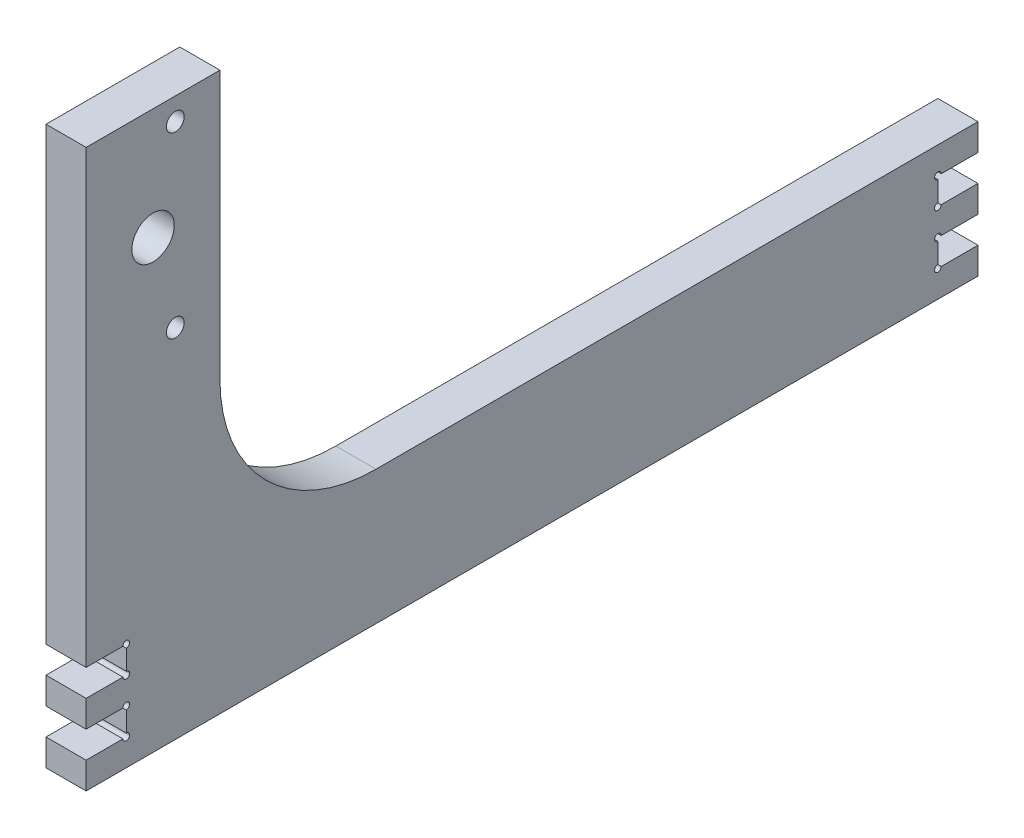
from build123d import *

# Parameters (mm, degrees)
SKETCH1_R           = 4
BOSS_EXTRUDE1_DEPTH = 18
CUT_EXTRUDE1_REACH  = 448.905
SKETCH3_R           = 9.5


with BuildPart() as part:
    # Sketch1 → Boss-Extrude1 (new body)
    with BuildSketch(Plane(origin=(0, 0, 0), x_dir=(0, 0, -1), z_dir=(1, 0, 0))):
        with BuildLine():
            Line((-30, -238), (-30, -250))
            Line((-30, -250), (370, -250))
            Line((370, -250), (370, -238))
            Line((370, -238), (353.5, -238))
            ThreePointArc((353.5, -238), (350.939339828, -239.060660172), (352, -236.5))
            Line((352, -236.5), (352, -227.5))
            ThreePointArc((352, -227.5), (350.939339828, -224.939339828), (353.5, -226))
            Line((353.5, -226), (370, -226))
            Line((370, -226), (370, -214))
            Line((370, -214), (353.5, -214))
            ThreePointArc((353.5, -214), (350.939339828, -215.060660172), (352, -212.5))
            Line((352, -212.5), (352, -203.5))
            ThreePointArc((352, -203.5), (350.939339828, -200.939339828), (353.5, -202))
            Line((353.5, -202), (370, -202))
            Line((370, -202), (370, -190))
            Line((370, -190), (100, -190))
            ThreePointArc((100, -190), (50.502525317, -169.497474683), (30, -120))
            Line((30, -120), (30, 0))
            Line((30, 0), (-30, 0))
            Line((-30, 0), (-30, -202))
            Line((-30, -202), (-13.5, -202))
            ThreePointArc((-13.5, -202), (-10.939339828, -200.939339828), (-12, -203.5))
            Line((-12, -203.5), (-12, -212.5))
            ThreePointArc((-12, -212.5), (-10.939339828, -215.060660172), (-13.5, -214))
            Line((-13.5, -214), (-30, -214))
            Line((-30, -214), (-30, -226))
            Line((-30, -226), (-13.5, -226))
            ThreePointArc((-13.5, -226), (-10.939339828, -224.939339828), (-12, -227.5))
            Line((-12, -227.5), (-12, -236.5))
            ThreePointArc((-12, -236.5), (-10.939339828, -239.060660172), (-13.5, -238))
            Line((-13.5, -238), (-30, -238))
        make_face()
        with Locations((10, -90)):
            Circle(SKETCH1_R, mode=Mode.SUBTRACT)
        with Locations((0, -50)):
            Circle(SKETCH1_R, mode=Mode.SUBTRACT)
        with Locations((10, -10)):
            Circle(SKETCH1_R, mode=Mode.SUBTRACT)
    extrude(amount=BOSS_EXTRUDE1_DEPTH)

    # Sketch3 → Cut-Extrude1 (cut, up to next)
    with BuildSketch(Plane(origin=(18, 0, 0), x_dir=(0, 0, -1), z_dir=(1, 0, 0)), mode=Mode.PRIVATE) as cut_extrude1_sk1:
        with Locations((0, -50)):
            Circle(SKETCH3_R)
    cut_extrude1_tool1 = extrude(cut_extrude1_sk1.sketch, amount=-CUT_EXTRUDE1_REACH, mode=Mode.PRIVATE) & part.part
    add(cut_extrude1_tool1.solids().sort_by_distance((18, -50, 0))[0], mode=Mode.SUBTRACT)


solid = part.part
